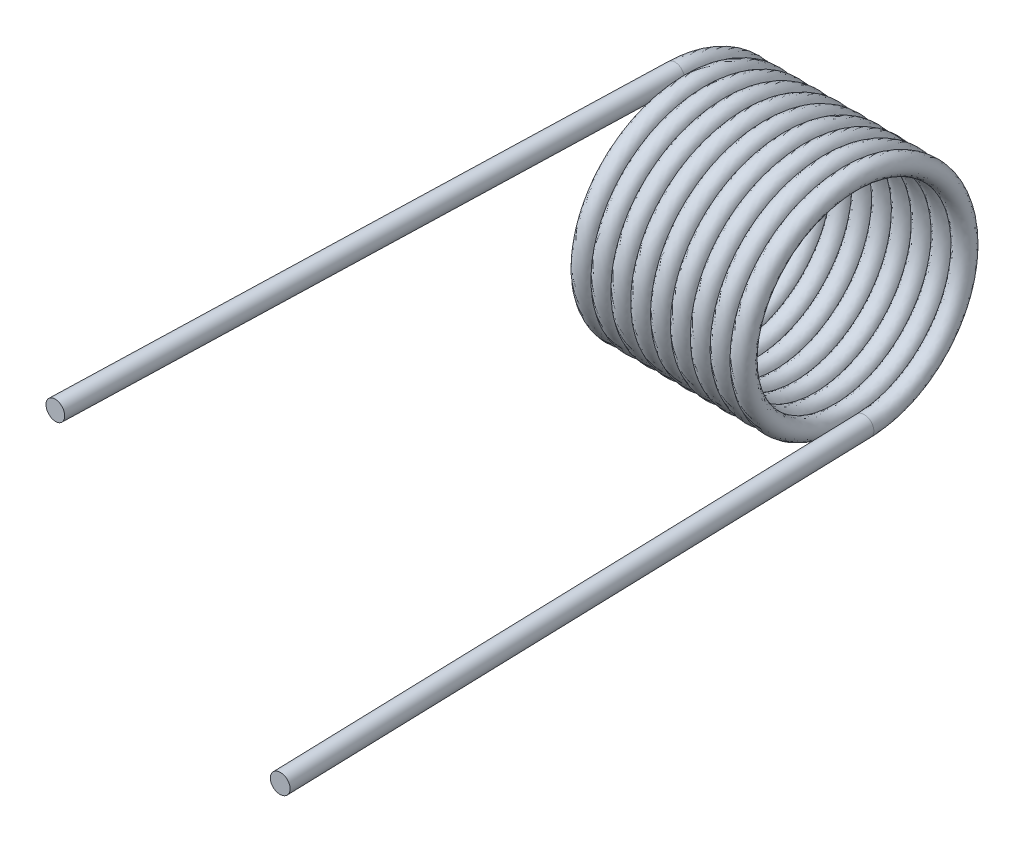
from build123d import *

# Parameters (mm, degrees)
SWEEP1_PITCH   = 0.8382
SKETCH3_R      = 0.4064
EXTRUDE1_DEPTH = 25.4
SKETCH4_R      = 0.4064
EXTRUDE2_DEPTH = 25.4


with BuildPart() as part:
    # Sweep1: the profile of Sketch2 screwed along a left-hand helix of 9.5 turns, 6 arcs to a turn; built about Z, then put on its axis
    sweep1_z = Axis((0, 0, 0), (0, 0, 1))
    sweep1_corners = [(4.701951723, 0.009445347, 0.314718219), (4.130140075, 0.007708184, 0.256836079), (4.188048277, -0.009445347, -0.314718219), (4.759859925, -0.007708184, -0.256836079)]
    with BuildLine(mode=Mode.PRIVATE) as sweep1_profile:
        ThreePointArc((4.701951723, 0.009445347, 0.314718219), (4.404052718, 0.012129378, 0.404149921), (4.130140075, 0.007708184, 0.256836079))
        ThreePointArc((4.130140075, 0.007708184, 0.256836079), (4.040668107, -0.00122836, -0.040928854), (4.188048277, -0.009445347, -0.314718219))
        ThreePointArc((4.188048277, -0.009445347, -0.314718219), (4.485947282, -0.012129378, -0.404149921), (4.759859925, -0.007708184, -0.256836079))
        ThreePointArc((4.759859925, -0.007708184, -0.256836079), (4.849331893, 0.00122836, 0.040928854), (4.701951723, 0.009445347, 0.314718219))
    sweep1_cap = Face(sweep1_profile.wire())
    sweep1_arcs = [((4.701951723, 0.009445347, 0.314718219), (4.387091798, 0.01715353, 0.571554299), (4.130140075, 0.007708184, 0.256836079), (1, 0.7071067811865475, 1)), ((4.130140075, 0.007708184, 0.256836079), (3.873188353, -0.001737163, -0.05788214), (4.188048277, -0.009445347, -0.314718219), (1, 0.7071067811865475, 1)), ((4.188048277, -0.009445347, -0.314718219), (4.502908202, -0.01715353, -0.571554299), (4.759859925, -0.007708184, -0.256836079), (1, 0.7071067811865475, 1)), ((4.759859925, -0.007708184, -0.256836079), (5.016811647, 0.001737163, 0.05788214), (4.701951723, 0.009445347, 0.314718219), (1, 0.7071067811865475, 1))]  # start, shoulder, end, weights
    sweep1_turn_angles = [0, -30, -60, -90, -120, -150, -180, -210, -240, -270, -300, -330, -360]
    sweep1_turn_weights = [1, 0.8660254037844387, 1, 0.8660254037844387, 1, 0.8660254037844387, 1, 0.8660254037844387, 1, 0.8660254037844387, 1, 0.8660254037844387, 1]
    sweep1_turn_sides = [Face.make_bezier_surface([[Vector(p[j][0], p[j][1], 0).rotate(sweep1_z, sweep1_turn_angles[2 * i + k]) / sweep1_turn_weights[2 * i + k] + Vector(0, 0, p[j][2] + -SWEEP1_PITCH * sweep1_turn_angles[2 * i + k] / 360) for k in range(3)] for j in range(3)], [[p[3][j] * sweep1_turn_weights[2 * i + k] for k in range(3)] for j in range(3)]) for p in sweep1_arcs for i in range(6)]
    sweep1_last_angles = [-3240, -3270, -3300, -3330, -3360, -3390, -3420]
    sweep1_last_weights = [1, 0.8660254037844387, 1, 0.8660254037844387, 1, 0.8660254037843473, 1]
    sweep1_last_sides = [Face.make_bezier_surface([[Vector(p[j][0], p[j][1], 0).rotate(sweep1_z, sweep1_last_angles[2 * i + k]) / sweep1_last_weights[2 * i + k] + Vector(0, 0, p[j][2] + -SWEEP1_PITCH * sweep1_last_angles[2 * i + k] / 360) for k in range(3)] for j in range(3)], [[p[3][j] * sweep1_last_weights[2 * i + k] for k in range(3)] for j in range(3)]) for p in sweep1_arcs for i in range(3)]
    sweep1 = Plane(origin=(0, 0, 0), x_dir=(0, 1, 0), z_dir=(1, 0, 0)) * Solid(Shell([*[p.moved(Location((0, 0, SWEEP1_PITCH * i))) for i in range(9) for p in sweep1_turn_sides], *sweep1_last_sides, sweep1_cap, sweep1_cap.rotate(sweep1_z, -3420).moved(Location((0, 0, -SWEEP1_PITCH * -3420 / 360)))]))
    add(sweep1)

    # Sketch3 → Extrude1 (add)
    with BuildSketch(Plane(origin=(0, 0, 0), x_dir=(-0.77440506742596, -0.6322630972036725, -0.023241502950838325), z_dir=(-0.02999856779925922, -3.011479954295737e-15, 0.999549941688755))):
        with Locations(Location((-2.810409467, -3.443780427, 0), (0, 0, 320.782712195))):
            Circle(SKETCH3_R)
    extrude(amount=EXTRUDE1_DEPTH)

    # Sketch4 → Extrude2 (add)
    with BuildSketch(Plane(origin=(0.007165926, 0, 0.238768088), x_dir=(0.8175231654982168, -0.575372818134623, -0.024535566543234636), z_dir=(0.029998567799259225, 1.2605715082880662e-13, 0.999549941688755))):
        with Locations(Location((9.067387391, 0.94404754, 0), (0, 0, 215.125745058))):
            Circle(SKETCH4_R)
    extrude(amount=EXTRUDE2_DEPTH)


solid = part.part
